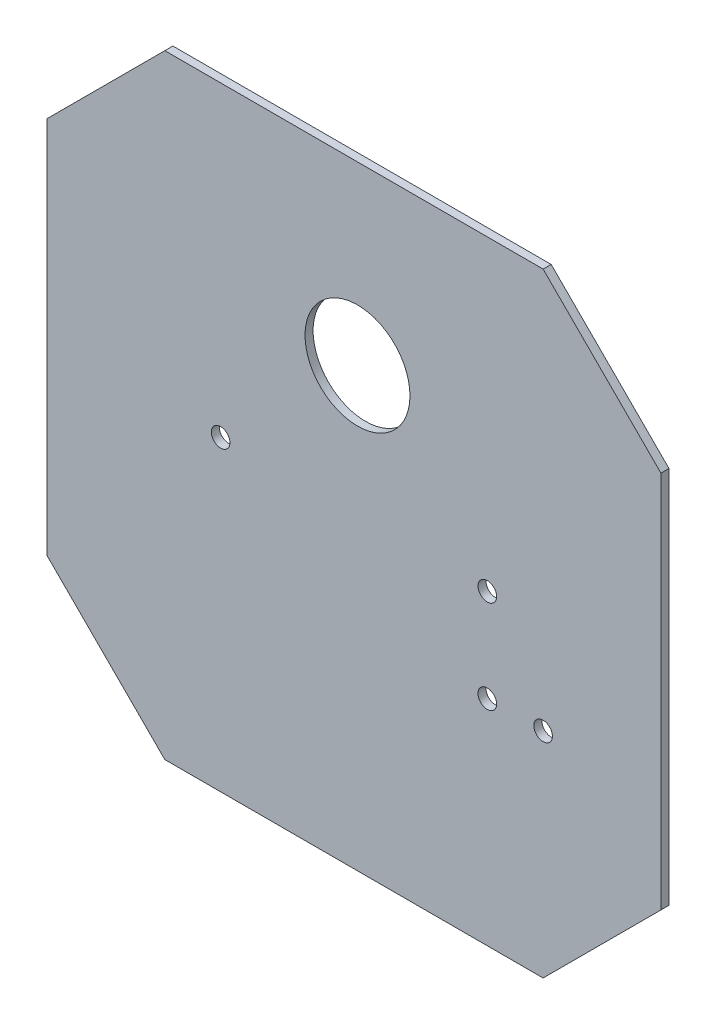
from build123d import *

# Parameters (mm, degrees)
SKETCH1_R           = 1.5
BOSS_EXTRUDE1_DEPTH = 1.3
SKETCH3_R           = 8.460587883
CUT_EXTRUDE1_DEPTH  = 20


with BuildPart() as part:
    # Sketch1 → Boss-Extrude1 (new body)
    with BuildSketch(Plane.XY):
        Polygon((-29.648967954, 62.034735519), (-29.648967954, 1.034735519), (-10.648967954, -17.965264481), (50.351032046, -17.965264481), (69.351032046, 1.034735519), (69.351032046, 62.034735519), (50.351032046, 81.034735519), (-10.648967954, 81.034735519), align=None)
        with Locations((-1.648967954, 31.534735519)):
            Circle(SKETCH1_R, mode=Mode.SUBTRACT)
        with Locations((41.351032046, 31.534735519)):
            Circle(SKETCH1_R, mode=Mode.SUBTRACT)
        with Locations((41.351032046, 16.534735519)):
            Circle(SKETCH1_R, mode=Mode.SUBTRACT)
        with Locations((50.351032046, 16.534735519)):
            Circle(SKETCH1_R, mode=Mode.SUBTRACT)
    extrude(amount=BOSS_EXTRUDE1_DEPTH)

    # Sketch3 → Cut-Extrude1 (cut)
    with BuildSketch(Plane.XY.offset(1.3)):
        with Locations((20.42010377, 52.605401567)):
            Circle(SKETCH3_R)
    extrude(amount=-CUT_EXTRUDE1_DEPTH, mode=Mode.SUBTRACT)


solid = part.part
